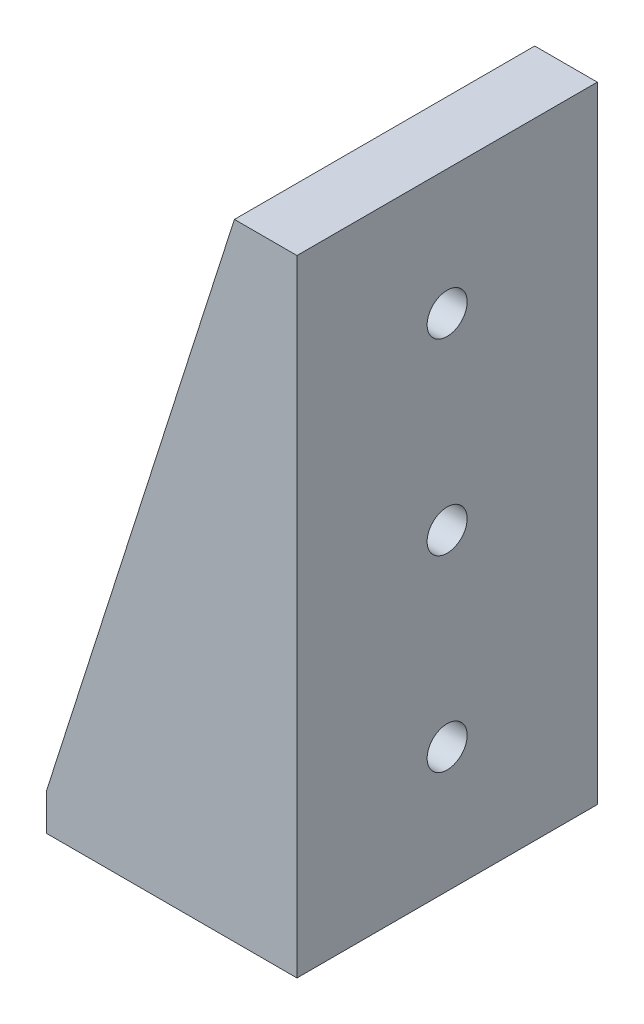
from build123d import *

# Parameters (mm, degrees)
BOSS_EXTRUDE1_DEPTH = 24
SKETCH4_W           = 19
SKETCH4_H           = 47.001372255
CUT_EXTRUDE2_DEPTH  = 15
SKETCH6_R           = 1.6
CUT_EXTRUDE4_DEPTH  = 5
CUT_EXTRUDE5_DEPTH  = 2.998627745
FILLET1_R           = 1


with BuildPart() as part:
    # Sketch1 → Boss-Extrude1 (new body)
    with BuildSketch(Plane.XY):
        Polygon((-10, 0), (10, 0), (10, 50), (5, 50), (-10, 3), align=None)
    extrude(amount=BOSS_EXTRUDE1_DEPTH)

    # Sketch4 → Cut-Extrude2 (cut)
    with BuildSketch(Plane.ZY.offset(10)):
        with Locations((12, 26.499313873)):
            Rectangle(SKETCH4_W, SKETCH4_H)
    extrude(amount=-CUT_EXTRUDE2_DEPTH, mode=Mode.SUBTRACT)

    # Sketch6 → Cut-Extrude4 (cut)
    with BuildSketch(Plane(origin=(10, 0, 0), x_dir=(0, 0, -1), z_dir=(1, 0, 0))):
        with Locations((-12, 25)):
            Circle(SKETCH6_R)
        with Locations((-12, 10)):
            Circle(SKETCH6_R)
        with Locations((-12, 40)):
            Circle(SKETCH6_R)
    extrude(amount=-CUT_EXTRUDE4_DEPTH, mode=Mode.SUBTRACT)

    # Sketch7 → Cut-Extrude5 (cut)
    with BuildSketch(Plane(origin=(0, 2.998627745, 0), x_dir=(1, 0, 0), z_dir=(0, 1, 0))):
        with BuildLine():
            Line((-7, -11), (3, -11))
            ThreePointArc((3, -11), (4, -12), (3, -13))
            Line((3, -13), (-7, -13))
            ThreePointArc((-7, -13), (-8, -12), (-7, -11))
        make_face()
    extrude(amount=-CUT_EXTRUDE5_DEPTH, mode=Mode.SUBTRACT)

    # Fillet1
    fillet1_edges = [part.edges().sort_by_distance(p)[0] for p in [
        (5, 2.998627745, 12),
        (-2.5, 2.998627745, 21.5),
        (-2.5, 2.998627745, 2.5),
    ]]
    fillet(fillet1_edges, radius=FILLET1_R - 0.0001)  # a hair under: the kernel refuses the full size


solid = part.part
